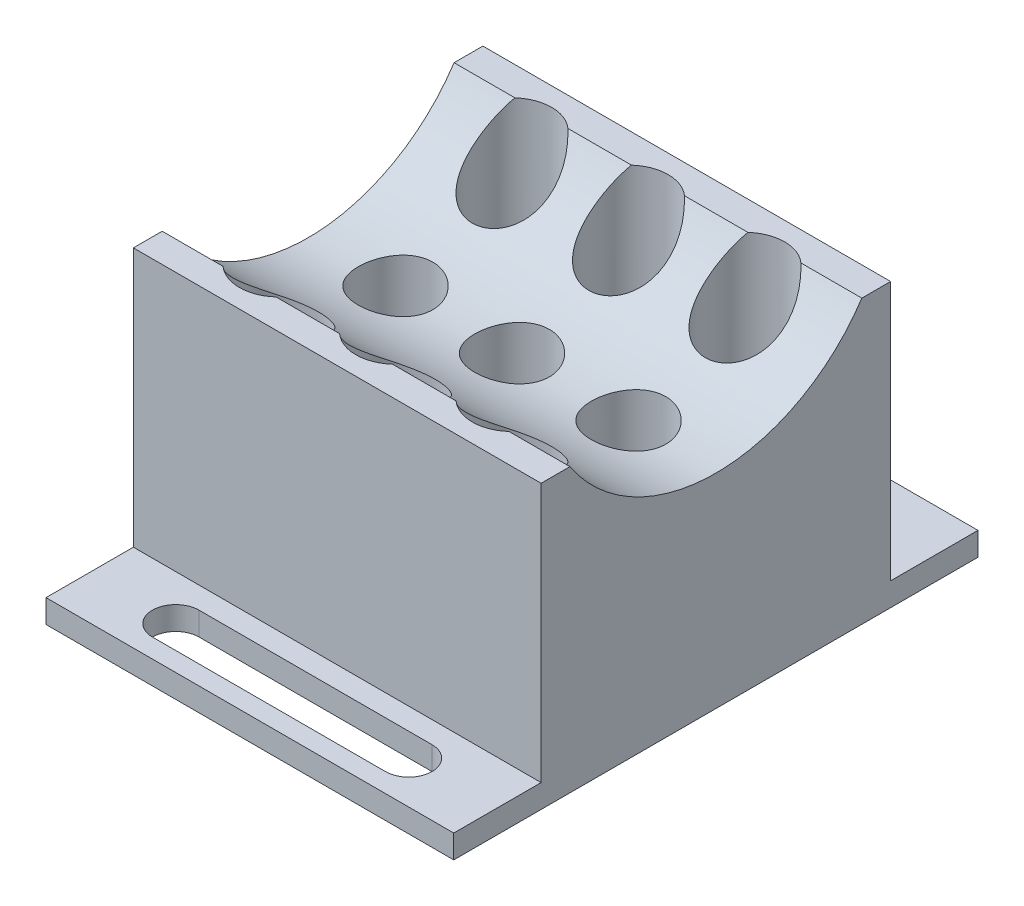
from build123d import *

# Parameters (mm, degrees)
SKETCH8_W                       = 35
SKETCH8_H                       = 30
BOSS_EXTRUDE7_DEPTH             = 80
CUT_EXTRUDE3_DEPTH              = 84.254129027
CUT_EXTRUDE3_DEPTH_BACK         = 84.254129027
SKETCH10_R                      = 15
CUT_EXTRUDE4_DEPTH              = 84.254129027
CUT_EXTRUDE4_DEPTH_BACK         = 84.254129027
SKETCH11_W                      = 38.336381606
SKETCH11_H                      = 16.50007926
CUT_EXTRUDE5_DEPTH              = 84.254129027
CUT_EXTRUDE5_DEPTH_BACK         = 84.254129027
SKETCH12_W                      = 33.824881692
SKETCH12_H                      = 7.5
CUT_EXTRUDE6_DEPTH              = 84.254129027
CUT_EXTRUDE6_DEPTH_BACK         = 84.254129027
SKETCH13_W                      = 45.541829225
SKETCH13_H                      = 41.48776408
SKETCH15_W                      = 35
SKETCH15_H                      = 7.5
BOSS_EXTRUDE9_DEPTH             = 2
CUT_EXTRUDE7_DEPTH              = 2
CUT_EXTRUDE10_DEPTH             = 34.447720401
CUT_EXTRUDE10_DEPTH_BACK        = 6.4
SKETCH18_R                      = 3.2
CUT_EXTRUDE11_REACH             = 35.448
SKETCH19_R                      = 3.4
CUT_EXTRUDE11_DIRECTION_2_DEPTH = 4.9


with BuildPart() as part:
    # Sketch8 → Boss-Extrude7 (new body)
    with BuildSketch(Plane(origin=(0, 0, 0), x_dir=(1, 0, 0), z_dir=(0, 1, 0))):
        Rectangle(SKETCH8_W, SKETCH8_H)
    extrude(amount=BOSS_EXTRUDE7_DEPTH)

    # Sketch10 → Cut-Extrude3 (cut, two sides: drawn at the far end of the back side and taken through both)
    with BuildSketch(Plane(origin=(0, 0, 0), x_dir=(0, 0, -1), z_dir=(1, 0, 0)).offset(-CUT_EXTRUDE3_DEPTH_BACK)):
        with Locations((0, 40)):
            Circle(SKETCH10_R)
    extrude(amount=CUT_EXTRUDE3_DEPTH + CUT_EXTRUDE3_DEPTH_BACK, mode=Mode.SUBTRACT)


with BuildPart() as cut_extrude3_piece_1:
    # of the separate pieces the step leaves, piece 1, a body of its own (cut_extrude3_pieces)
    add(part.part.solids().sort_by_distance((-17.5, 0, 15))[0])


with BuildPart() as cut_extrude3_piece_2:
    # of the separate pieces the step leaves, piece 2, a body of its own (cut_extrude3_pieces)
    add(part.part.solids().sort_by_distance((-17.5, 80, 15))[0])


with BuildPart() as cut_extrude4_tool:
    # Sketch11 → Cut-Extrude4 (new, two sides: drawn at the far end of the back side and taken through both)
    with BuildSketch(Plane(origin=(0, 0, 0), x_dir=(0, 0, -1), z_dir=(1, 0, 0)).offset(-CUT_EXTRUDE4_DEPTH_BACK)):
        with Locations((0, 40)):
            Rectangle(SKETCH11_W, SKETCH11_H)
    extrude(amount=CUT_EXTRUDE4_DEPTH + CUT_EXTRUDE4_DEPTH_BACK)


with BuildPart() as cut_extrude3_piece_1_1:
    add(cut_extrude3_piece_1.part)

    # Cut-Extrude4: cut by cut_extrude4_tool
    add(cut_extrude4_tool.part, mode=Mode.SUBTRACT)

    # Sketch12 → Cut-Extrude5 (cut, two sides: drawn at the far end of the back side and taken through both)
    with BuildSketch(Plane(origin=(0, 0, 0), x_dir=(0, 0, -1), z_dir=(1, 0, 0)).offset(-CUT_EXTRUDE5_DEPTH_BACK)):
        with Locations((0.439040256, 3.75)):
            Rectangle(SKETCH12_W, SKETCH12_H)
    extrude(amount=CUT_EXTRUDE5_DEPTH + CUT_EXTRUDE5_DEPTH_BACK, mode=Mode.SUBTRACT)

    # Sketch15 → Boss-Extrude9 (add)
    with BuildSketch(Plane(origin=(0, 7.5, 0), x_dir=(-1, 0, 0), z_dir=(0, -1, 0))):
        with Locations((0, -18.75)):
            Rectangle(SKETCH15_W, SKETCH15_H)
        with Locations((0, 18.75)):
            Rectangle(SKETCH15_W, SKETCH15_H)
    extrude(amount=-BOSS_EXTRUDE9_DEPTH)

    # Sketch16 → Cut-Extrude7 (cut)
    with BuildSketch(Plane(origin=(0, 7.5, 0), x_dir=(-1, 0, 0), z_dir=(0, -1, 0))):
        with BuildLine():
            Line((10, -20.863517543), (-10, -20.863517543))
            ThreePointArc((-10, -20.863517543), (-12, -18.863517543), (-10, -16.863517543))
            Line((-10, -16.863517543), (10, -16.863517543))
            ThreePointArc((10, -16.863517543), (12, -18.863517543), (10, -20.863517543))
        make_face()
        with BuildLine():
            Line((10, 16.803450623), (-10, 16.803450623))
            ThreePointArc((-10, 16.803450623), (-12, 18.803450623), (-10, 20.803450623))
            Line((-10, 20.803450623), (10, 20.803450623))
            ThreePointArc((10, 20.803450623), (12, 18.803450623), (10, 16.803450623))
        make_face()
    extrude(amount=-CUT_EXTRUDE7_DEPTH, mode=Mode.SUBTRACT)

    # Sketch18 → Cut-Extrude10 (cut, two sides: drawn at the far end of the back side and taken through both)
    with BuildSketch(Plane(origin=(0, 25, 0), x_dir=(1, 0, 0), z_dir=(0, 1, 0)).offset(-CUT_EXTRUDE10_DEPTH_BACK)):
        Circle(SKETCH18_R)
        with Locations((10, 0)):
            Circle(SKETCH18_R)
        with Locations((-10, 0)):
            Circle(SKETCH18_R)
    extrude(amount=CUT_EXTRUDE10_DEPTH + CUT_EXTRUDE10_DEPTH_BACK, mode=Mode.SUBTRACT)

    # Sketch19 → Cut-Extrude11 (cut, up to next)
    with BuildSketch(Plane(origin=(0, 25, 0), x_dir=(1, 0, 0), z_dir=(0, 1, 0)), mode=Mode.PRIVATE) as cut_extrude11_sk1:
        with Locations((-10, -10)):
            Circle(SKETCH19_R)
    cut_extrude11_tool1 = extrude(cut_extrude11_sk1.sketch, amount=CUT_EXTRUDE11_REACH, mode=Mode.PRIVATE) & cut_extrude3_piece_1_1.part
    # Sketch19 → Cut-Extrude11 (cut, up to next)
    with BuildSketch(Plane(origin=(0, 25, 0), x_dir=(1, 0, 0), z_dir=(0, 1, 0)), mode=Mode.PRIVATE) as cut_extrude11_sk2:
        with Locations((0, -10)):
            Circle(SKETCH19_R)
    cut_extrude11_tool2 = extrude(cut_extrude11_sk2.sketch, amount=CUT_EXTRUDE11_REACH, mode=Mode.PRIVATE) & cut_extrude3_piece_1_1.part
    # Sketch19 → Cut-Extrude11 (cut, up to next)
    with BuildSketch(Plane(origin=(0, 25, 0), x_dir=(1, 0, 0), z_dir=(0, 1, 0)), mode=Mode.PRIVATE) as cut_extrude11_sk3:
        with Locations((10, -10)):
            Circle(SKETCH19_R)
    cut_extrude11_tool3 = extrude(cut_extrude11_sk3.sketch, amount=CUT_EXTRUDE11_REACH, mode=Mode.PRIVATE) & cut_extrude3_piece_1_1.part
    # Sketch19 → Cut-Extrude11 (cut, up to next)
    with BuildSketch(Plane(origin=(0, 25, 0), x_dir=(1, 0, 0), z_dir=(0, 1, 0)), mode=Mode.PRIVATE) as cut_extrude11_sk4:
        with Locations((-10, 10)):
            Circle(SKETCH19_R)
    cut_extrude11_tool4 = extrude(cut_extrude11_sk4.sketch, amount=CUT_EXTRUDE11_REACH, mode=Mode.PRIVATE) & cut_extrude3_piece_1_1.part
    # Sketch19 → Cut-Extrude11 (cut, up to next)
    with BuildSketch(Plane(origin=(0, 25, 0), x_dir=(1, 0, 0), z_dir=(0, 1, 0)), mode=Mode.PRIVATE) as cut_extrude11_sk5:
        with Locations((0, 10)):
            Circle(SKETCH19_R)
    cut_extrude11_tool5 = extrude(cut_extrude11_sk5.sketch, amount=CUT_EXTRUDE11_REACH, mode=Mode.PRIVATE) & cut_extrude3_piece_1_1.part
    # Sketch19 → Cut-Extrude11 (cut, up to next)
    with BuildSketch(Plane(origin=(0, 25, 0), x_dir=(1, 0, 0), z_dir=(0, 1, 0)), mode=Mode.PRIVATE) as cut_extrude11_sk6:
        with Locations((10, 10)):
            Circle(SKETCH19_R)
    cut_extrude11_tool6 = extrude(cut_extrude11_sk6.sketch, amount=CUT_EXTRUDE11_REACH, mode=Mode.PRIVATE) & cut_extrude3_piece_1_1.part
    add(cut_extrude11_tool1.solids().sort_by_distance((-10, 25, 10))[0], mode=Mode.SUBTRACT)
    add(cut_extrude11_tool2.solids().sort_by_distance((0, 25, 10))[0], mode=Mode.SUBTRACT)
    add(cut_extrude11_tool3.solids().sort_by_distance((10, 25, 10))[0], mode=Mode.SUBTRACT)
    add(cut_extrude11_tool4.solids().sort_by_distance((-10, 25, -10))[0], mode=Mode.SUBTRACT)
    add(cut_extrude11_tool5.solids().sort_by_distance((0, 25, -10))[0], mode=Mode.SUBTRACT)
    add(cut_extrude11_tool6.solids().sort_by_distance((10, 25, -10))[0], mode=Mode.SUBTRACT)

    # Sketch19 → Cut-Extrude11 direction 2 (cut)
    with BuildSketch(Plane(origin=(0, 25, 0), x_dir=(1, 0, 0), z_dir=(0, 1, 0))):
        with Locations((-10, -10)):
            Circle(SKETCH19_R)
        with Locations((0, -10)):
            Circle(SKETCH19_R)
        with Locations((10, -10)):
            Circle(SKETCH19_R)
        with Locations((-10, 10)):
            Circle(SKETCH19_R)
        with Locations((0, 10)):
            Circle(SKETCH19_R)
        with Locations((10, 10)):
            Circle(SKETCH19_R)
    extrude(amount=-CUT_EXTRUDE11_DIRECTION_2_DEPTH, mode=Mode.SUBTRACT)


with BuildPart() as cut_extrude3_piece_2_1:
    add(cut_extrude3_piece_2.part)

    # Cut-Extrude4: cut by cut_extrude4_tool
    add(cut_extrude4_tool.part, mode=Mode.SUBTRACT)

    # Sketch13 → Cut-Extrude6 (cut, two sides: drawn at the far end of the back side and taken through both)
    with BuildSketch(Plane(origin=(0, 0, 0), x_dir=(0, 0, -1), z_dir=(1, 0, 0)).offset(-CUT_EXTRUDE6_DEPTH_BACK)):
        with Locations((-6.569234617, 60.808180877)):
            Rectangle(SKETCH13_W, SKETCH13_H)
    extrude(amount=CUT_EXTRUDE6_DEPTH + CUT_EXTRUDE6_DEPTH_BACK, mode=Mode.SUBTRACT)


solid = cut_extrude3_piece_1_1.part
